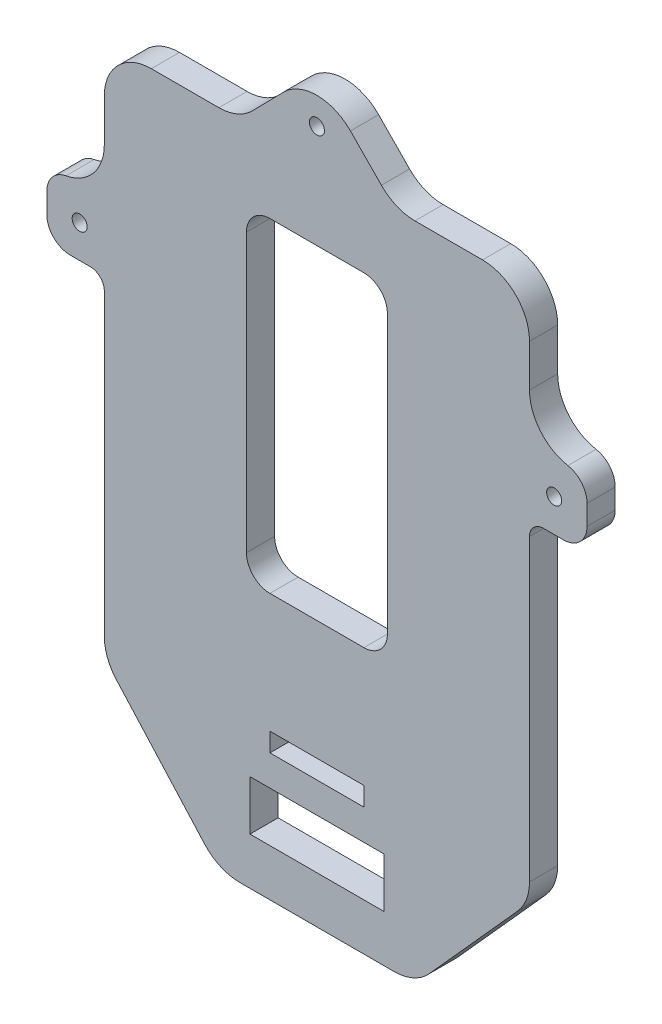
from build123d import *

# Parameters (mm, degrees)
ESBO_O1_W                = 20
ESBO_O1_H                = 4
ESBO_O1_W_2              = 28.5
ESBO_O1_H_2              = 10.6
ESBO_O1_R                = 1.6
ESBO_O1_W_3              = 30
ESBO_O1_H_3              = 69.1
RESSALTO_EXTRUS_O1_DEPTH = 6
FILETE3_R                = 3
FILETE4_R                = 10
FILETE5_R                = 5


with BuildPart() as part:
    # Esboço1 → Ressalto-extrusão1 (new body)
    with BuildSketch(Plane.XY):
        Polygon((-45.25, 13.75), (-45.25, -56.75), (-20.906753417, -83.85), (20.906753417, -83.85), (45.25, -56.75), (45.25, 13.75), (57.5, 13.75), (57.5, 27.75), (45.25, 27.75), (45.25, 56.75), (16.663333, 56.75), (0, 73.75), (-16.663333, 56.75), (-45.25, 56.75), (-45.25, 27.75), (-57.5, 27.75), (-57.5, 13.75), align=None)
        with Locations((0, -54.75)):
            Rectangle(ESBO_O1_W, ESBO_O1_H, mode=Mode.SUBTRACT)
        with Locations((0, -68.55)):
            Rectangle(ESBO_O1_W_2, ESBO_O1_H_2, mode=Mode.SUBTRACT)
        with Locations((-50.5, 20.75)):
            Circle(ESBO_O1_R, mode=Mode.SUBTRACT)
        with Locations((0, 7.2)):
            Rectangle(ESBO_O1_W_3, ESBO_O1_H_3, mode=Mode.SUBTRACT)
        with Locations((0, 63.75)):
            Circle(ESBO_O1_R, mode=Mode.SUBTRACT)
        with Locations((50.5, 20.75)):
            Circle(ESBO_O1_R, mode=Mode.SUBTRACT)
    extrude(amount=RESSALTO_EXTRUS_O1_DEPTH)

    # Filete3
    filete3_edges = [part.edges().sort_by_distance(p)[0] for p in [
        (45.25, 13.75, 3),
        (-45.25, 13.75, 3),
    ]]
    fillet(filete3_edges, radius=FILETE3_R)

    # Filete4
    filete4_edges = [part.edges().sort_by_distance(p)[0] for p in [
        (-16.663333, 56.75, 3),
        (16.663333, 56.75, 3),
        (-45.25, 27.75, 3),
        (45.25, 27.75, 3),
        (0, 73.75, 3),
        (45.25, 56.75, 3),
        (-45.25, 56.75, 3),
        (-45.25, -56.75, 3),
        (45.25, -56.75, 3),
        (20.906753417, -83.85, 3),
        (-20.906753417, -83.85, 3),
    ]]
    fillet(filete4_edges, radius=FILETE4_R)

    # Filete5
    filete5_edges = [part.edges().sort_by_distance(p)[0] for p in [
        (57.5, 13.75, 3),
        (57.5, 27.75, 3),
        (-57.5, 13.75, 3),
        (-57.5, 27.75, 3),
        (-15, -27.35, 3),
        (15, -27.35, 3),
        (15, 41.75, 3),
        (-15, 41.75, 3),
    ]]
    fillet(filete5_edges, radius=FILETE5_R)


solid = part.part
